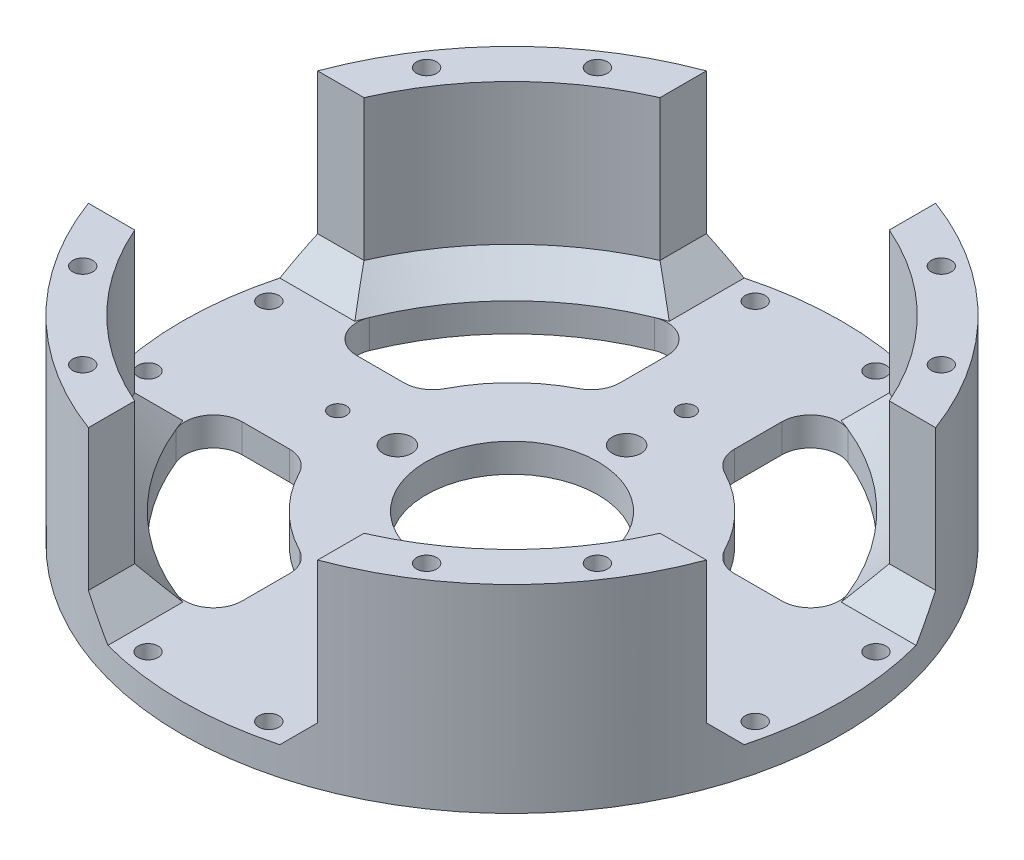
from build123d import *

# Parameters (mm, degrees)
SKETCH1_R           = 57.5
BOSS_EXTRUDE1_DEPTH = 34.6
SKETCH2_R           = 50
CUT_EXTRUDE1_DEPTH  = 29.6
SKETCH3_R           = 2.5
SKETCH3_R_2         = 15
CUT_EXTRUDE2_DEPTH  = 31.8
SKETCH4_R           = 1.5
SKETCH4_R_2         = 1.75
CUT_EXTRUDE3_DEPTH  = 50
SKETCH9_W           = 40
SKETCH9_H           = 29.6
CUT_EXTRUDE4_DEPTH  = 72
CIRPATTERN1_COUNT   = 4
FILLET2_R           = 5
CHAMFER1_SIZE       = 5


with BuildPart() as part:
    # Sketch1 → Boss-Extrude1 (new body)
    with BuildSketch(Plane(origin=(0, 0, 0), x_dir=(1, 0, 0), z_dir=(0, 1, 0))):
        with Locations(Location((0, 0, 0), (0, 0, 270))):
            Circle(SKETCH1_R)
    extrude(amount=BOSS_EXTRUDE1_DEPTH)

    # Sketch2 → Cut-Extrude1 (cut)
    with BuildSketch(Plane(origin=(0, 34.6, 0), x_dir=(1, 0, 0), z_dir=(0, 1, 0))):
        with Locations(Location((0, 0, 0), (0, 0, 270))):
            Circle(SKETCH2_R)
    extrude(amount=-CUT_EXTRUDE1_DEPTH, mode=Mode.SUBTRACT)

    # Sketch3 → Cut-Extrude2 (cut)
    with BuildSketch(Plane.XZ):
        with BuildLine():
            Line((-10, 25.617376915), (-10, 43.874821937))
            ThreePointArc((-10, 43.874821937), (-31.819805153, 31.819805153), (-43.874821937, 10))
            Line((-43.874821937, 10), (-25.617376915, 10))
            ThreePointArc((-25.617376915, 10), (-19.445436483, 19.445436483), (-10, 25.617376915))
        make_face()
        with BuildLine():
            Line((25.617376915, 10), (43.874821937, 10))
            ThreePointArc((43.874821937, 10), (31.819805153, 31.819805153), (10, 43.874821937))
            Line((10, 43.874821937), (10, 25.617376915))
            ThreePointArc((10, 25.617376915), (19.445436483, 19.445436483), (25.617376915, 10))
        make_face()
        with BuildLine():
            ThreePointArc((10, -43.874821937), (31.819805153, -31.819805153), (43.874821937, -10))
            Line((43.874821937, -10), (25.617376915, -10))
            ThreePointArc((25.617376915, -10), (19.445436483, -19.445436483), (10, -25.617376915))
            Line((10, -25.617376915), (10, -43.874821937))
        make_face()
        with BuildLine():
            ThreePointArc((-43.874821937, -10), (-31.819805153, -31.819805153), (-10, -43.874821937))
            Line((-10, -43.874821937), (-10, -25.617376915))
            ThreePointArc((-10, -25.617376915), (-19.445436483, -19.445436483), (-25.617376915, -10))
            Line((-25.617376915, -10), (-43.874821937, -10))
        make_face()
        with Locations(Location((-20, 0, 0), (0, 0, 270))):
            Circle(SKETCH3_R)
        with Locations(Location((0, 0, 0), (0, 0, 270))):
            Circle(SKETCH3_R_2)
        with Locations(Location((0, 20, 0), (0, 0, 270))):
            Circle(SKETCH3_R)
        with Locations(Location((20, 0, 0), (0, 0, 270))):
            Circle(SKETCH3_R)
        with Locations(Location((0, -20, 0), (0, 0, 270))):
            Circle(SKETCH3_R)
    extrude(amount=-CUT_EXTRUDE2_DEPTH, mode=Mode.SUBTRACT)

    # Sketch4 → Cut-Extrude3 (cut)
    with BuildSketch(Plane.XZ):
        with Locations(Location((0, 30.405591591, 0), (0, 0, 270))):
            Circle(SKETCH4_R)
        with Locations(Location((30.405591591, 0, 0), (0, 0, 270))):
            Circle(SKETCH4_R)
        with Locations(Location((0, -30.405591591, 0), (0, 0, 270))):
            Circle(SKETCH4_R)
        with Locations(Location((-30.405591591, 0, 0), (0, 0, 270))):
            Circle(SKETCH4_R)
        with Locations(Location((-10.534877389, 52.962405142, 0), (0, 0, 270))):
            Circle(SKETCH4_R_2)
        with Locations(Location((10.534877389, 52.962405142, 0), (0, 0, 270))):
            Circle(SKETCH4_R_2)
        with Locations(Location((30.000792583, 44.899359064, 0), (0, 0, 270))):
            Circle(SKETCH4_R_2)
        with Locations(Location((44.899359064, 30.000792583, 0), (0, 0, 270))):
            Circle(SKETCH4_R_2)
        with Locations(Location((52.962405142, 10.534877389, 0), (0, 0, 270))):
            Circle(SKETCH4_R_2)
        with Locations(Location((52.962405142, -10.534877389, 0), (0, 0, 270))):
            Circle(SKETCH4_R_2)
        with Locations(Location((44.899359064, -30.000792583, 0), (0, 0, 270))):
            Circle(SKETCH4_R_2)
        with Locations(Location((30.000792583, -44.899359064, 0), (0, 0, 270))):
            Circle(SKETCH4_R_2)
        with Locations(Location((10.534877389, -52.962405142, 0), (0, 0, 270))):
            Circle(SKETCH4_R_2)
        with Locations(Location((-10.534877389, -52.962405142, 0), (0, 0, 270))):
            Circle(SKETCH4_R_2)
        with Locations(Location((-30.000792583, -44.899359064, 0), (0, 0, 270))):
            Circle(SKETCH4_R_2)
        with Locations(Location((-44.899359064, -30.000792583, 0), (0, 0, 270))):
            Circle(SKETCH4_R_2)
        with Locations(Location((-52.962405142, -10.534877389, 0), (0, 0, 270))):
            Circle(SKETCH4_R_2)
        with Locations(Location((-52.962405142, 10.534877389, 0), (0, 0, 270))):
            Circle(SKETCH4_R_2)
        with Locations(Location((-44.899359064, 30.000792583, 0), (0, 0, 270))):
            Circle(SKETCH4_R_2)
        with Locations(Location((-30.000792583, 44.899359064, 0), (0, 0, 270))):
            Circle(SKETCH4_R_2)
    extrude(amount=-CUT_EXTRUDE3_DEPTH, mode=Mode.SUBTRACT)

    # Sketch9 → Cut-Extrude4 (cut)
    with BuildSketch(Plane.XY):
        with Locations((0, 19.8)):
            Rectangle(SKETCH9_W, SKETCH9_H)
    cut_extrude4 = extrude(amount=-CUT_EXTRUDE4_DEPTH, mode=Mode.SUBTRACT)

    # CirPattern1: Cut-Extrude4 ×4 about axis
    cirpattern1_axis = Axis((0, 0, 0), (0, 1, 0))
    for i in range(1, CIRPATTERN1_COUNT):
        add(cut_extrude4.rotate(cirpattern1_axis, i * 360 / CIRPATTERN1_COUNT), mode=Mode.SUBTRACT)

    # Fillet2
    fillet2_edges = [part.edges().sort_by_distance(p)[0] for p in [
        (43.874821937, 2.5, 10),
        (25.617376915, 2.5, 10),
        (10, 2.5, 25.617376915),
        (10, 2.5, 43.874821937),
        (10, 2.5, -43.874821937),
        (10, 2.5, -25.617376915),
        (25.617376915, 2.5, -10),
        (43.874821937, 2.5, -10),
        (-43.874821937, 2.5, -10),
        (-25.617376915, 2.5, -10),
        (-10, 2.5, -25.617376915),
        (-10, 2.5, -43.874821937),
        (-10, 2.5, 43.874821937),
        (-10, 2.5, 25.617376915),
        (-25.617376915, 2.5, 10),
        (-43.874821937, 2.5, 10),
    ]]
    fillet(fillet2_edges, radius=FILLET2_R)

    # Chamfer1
    chamfer1_edges = [part.edges().sort_by_distance(p)[0] for p in [
        (-35.355339059, 5, -35.355339059),
        (-20, 5, -49.867701791),
        (20, 5, -49.867701791),
        (-35.355339059, 5, 35.355339059),
        (35.355339059, 5, 35.355339059),
        (35.355339059, 5, -35.355339059),
        (-49.867701791, 5, 20),
        (20, 5, 49.867701791),
        (49.867701791, 5, -20),
        (49.867701791, 5, 20),
        (-20, 5, 49.867701791),
        (-49.867701791, 5, -20),
    ]]
    chamfer(chamfer1_edges, length=CHAMFER1_SIZE - 0.0001)  # a hair under: the kernel refuses the full size


solid = part.part
